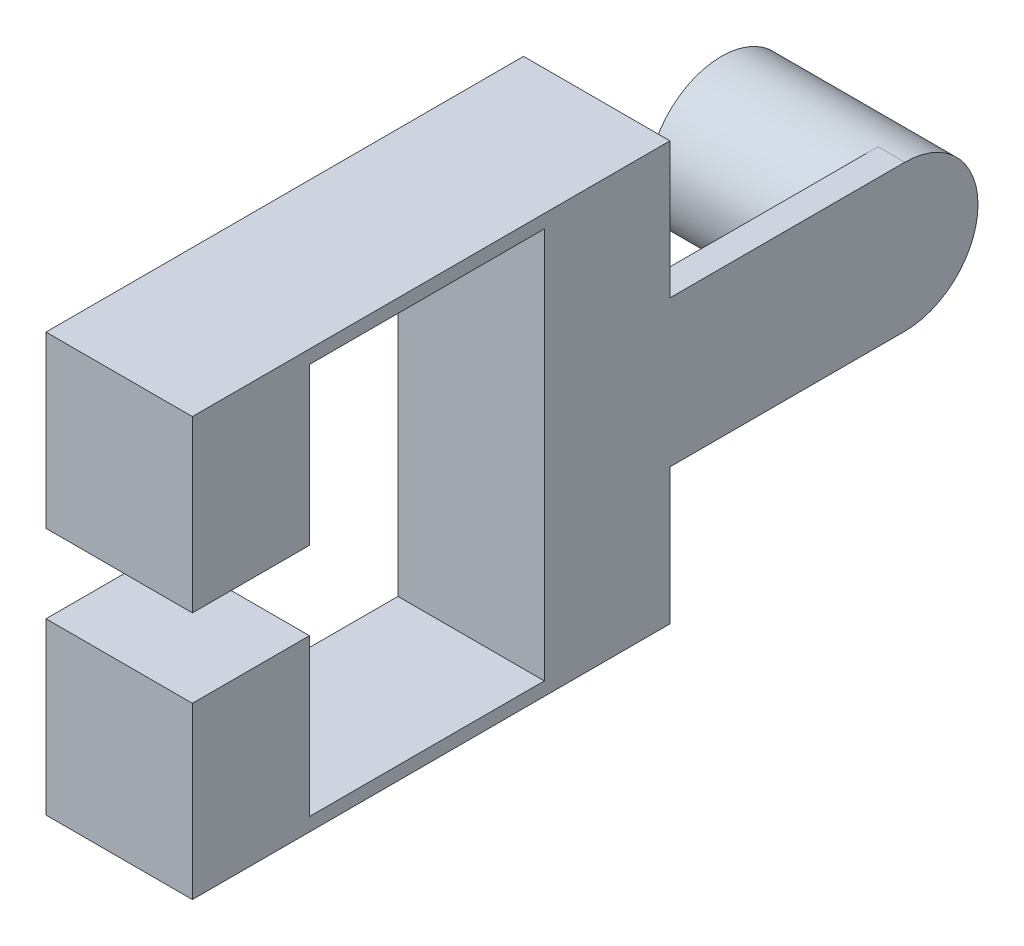
from build123d import *

# Parameters (mm, degrees)
SKETCH1_R           = 11.873640169
BOSS_EXTRUDE1_DEPTH = 25.4
BOSS_EXTRUDE2_DEPTH = 4.359372013
SKETCH3_W           = 23.747280338
SKETCH3_H           = 63.5
BOSS_EXTRUDE3_DEPTH = 20.377197654
SKETCH6_W           = 23.747280338
SKETCH6_H           = 58.477197654
BOSS_EXTRUDE4_DEPTH = 2.179686006
SKETCH7_W           = 23.747280338
SKETCH7_H           = 58.477197654
BOSS_EXTRUDE5_DEPTH = 2.179686006
SKETCH8_W           = 23.747280338
SKETCH8_H           = 27.579686006
BOSS_EXTRUDE6_DEPTH = 18.991849144


with BuildPart() as part:
    # Sketch1 → Boss-Extrude1 (new body)
    with BuildSketch(Plane.YZ):
        Circle(SKETCH1_R)
    extrude(amount=BOSS_EXTRUDE1_DEPTH)

    # Sketch2 → Boss-Extrude2 (add)
    with BuildSketch(Plane.YZ.offset(25.4)):
        with BuildLine():
            Line((-11.873640169, -1.316e-06), (-11.873640169, 38.099998684))
            Line((-11.873640169, 38.099998684), (11.873640169, 38.099998684))
            Line((11.873640169, 38.099998684), (11.873640169, 0))
            ThreePointArc((11.873640169, 0), (6.58e-07, -11.873640169), (-11.873640169, -1.316e-06))
        make_face()
    extrude(amount=BOSS_EXTRUDE2_DEPTH)

    # Sketch3 → Boss-Extrude3 (add)
    with BuildSketch(Plane.XY.offset(38.099998684)):
        with Locations((17.885731844, 0)):
            Rectangle(SKETCH3_W, SKETCH3_H)
    extrude(amount=BOSS_EXTRUDE3_DEPTH)

    # Sketch6 → Boss-Extrude4 (add)
    with BuildSketch(Plane(origin=(0, 31.75, 0), x_dir=(-1, 0, 0), z_dir=(0, 1, 0))):
        with Locations((-17.885731844, 67.338597511)):
            Rectangle(SKETCH6_W, SKETCH6_H)
    extrude(amount=BOSS_EXTRUDE4_DEPTH)

    # Sketch7 → Boss-Extrude5 (add)
    with BuildSketch(Plane.XZ.offset(31.75)):
        with Locations((17.885731844, 67.338597511)):
            Rectangle(SKETCH7_W, SKETCH7_H)
    extrude(amount=BOSS_EXTRUDE5_DEPTH)

    # Sketch8 → Boss-Extrude6 (add)
    with BuildSketch(Plane.XY.offset(96.577196338)):
        with Locations((17.885731844, 20.139843003)):
            Rectangle(SKETCH8_W, SKETCH8_H)
        with Locations((17.885731844, -20.139843003)):
            Rectangle(SKETCH8_W, SKETCH8_H)
    extrude(amount=BOSS_EXTRUDE6_DEPTH)


solid = part.part
